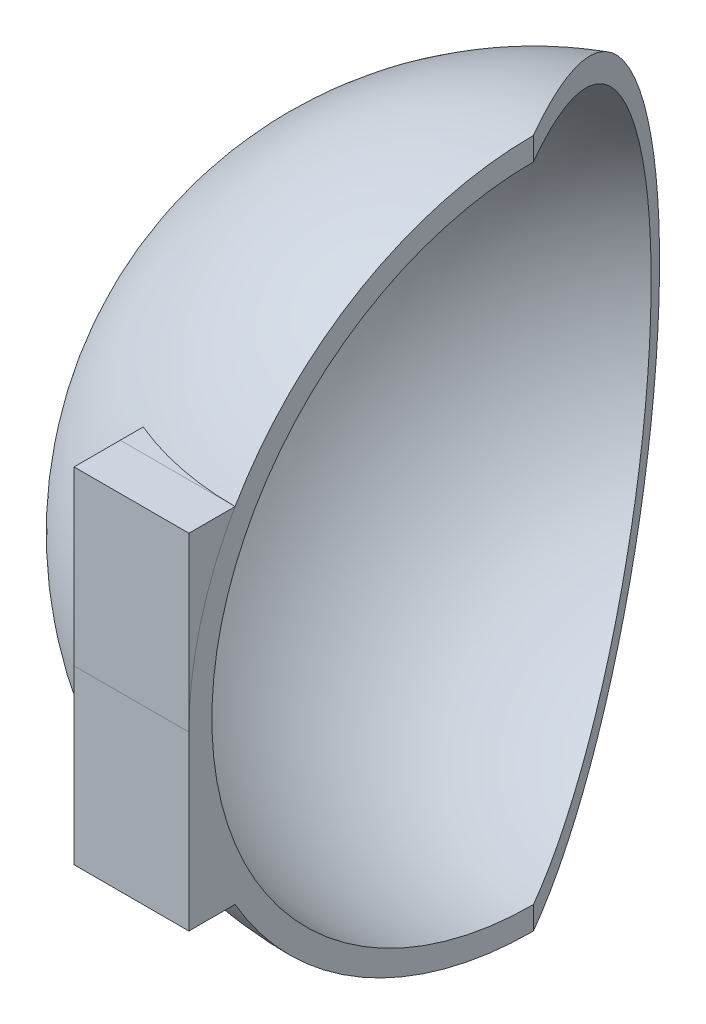
from build123d import *

# Parameters (mm, degrees)
REVOLVE1_ANGLE      = 150
BOSS_EXTRUDE1_DEPTH = 10
BOSS_EXTRUDE2_START = -10
BOSS_EXTRUDE2_DEPTH = 10


with BuildPart() as part:
    # Sketch1 → Revolve1 (revolve)
    with BuildSketch(Plane.YZ):
        with BuildLine():
            Line((-28, 0), (-30, 0))
            ThreePointArc((-30, 0), (0, 30), (30, 0))
            Line((30, 0), (28, 0))
            ThreePointArc((28, 0), (0, 28), (-28, 0))
        make_face()
    revolve(axis=Axis((0, -28, 0), (0, -1, 0)), revolution_arc=REVOLVE1_ANGLE)

    # Boss-Extrude2: read off the stored shape, not the designer's step
    # Boss-Extrude2 outline → Boss-Extrude2 (add)
    with BuildSketch(Plane(origin=(-10, 0, 0), x_dir=(0, -1, 0), z_dir=(-1, 0, 0)).offset(BOSS_EXTRUDE2_START)):
        with BuildLine():
            Line((-15, 25.980762114), (-15, 23.979157617))
            ThreePointArc((-15, 23.979157617), (-7.802788017, 27.186697099), (0, 28.284271247))
            Line((0, 28.284271247), (0, 30))
            ThreePointArc((0, 30), (-7.764571353, 28.977774789), (-15, 25.980762114))
        make_face()
    boss_extrude2 = extrude(amount=BOSS_EXTRUDE2_DEPTH)


with BuildPart() as body_2:
    # Sketch2 → Boss-Extrude1 (new body)
    with BuildSketch(Plane.YZ):
        with BuildLine():
            Line((15, 30), (0, 30))
            ThreePointArc((0, 30), (7.764571353, 28.977774789), (15, 25.980762114))
            Line((15, 25.980762114), (15, 30))
        make_face()
    boss_extrude1 = extrude(amount=-BOSS_EXTRUDE1_DEPTH)


with BuildPart() as part_1:
    add(part.part)

    # Mirror1: Boss-Extrude1, Boss-Extrude2 across plane
    add(boss_extrude1.mirror(Plane(origin=(30.001, 0, 0), x_dir=(0, 0, 1), z_dir=(0, 1, 0))))
    add(boss_extrude2.mirror(Plane(origin=(30.001, 0, 0), x_dir=(0, 0, 1), z_dir=(0, 1, 0))))


solid = Compound([body_2.part, part_1.part])
